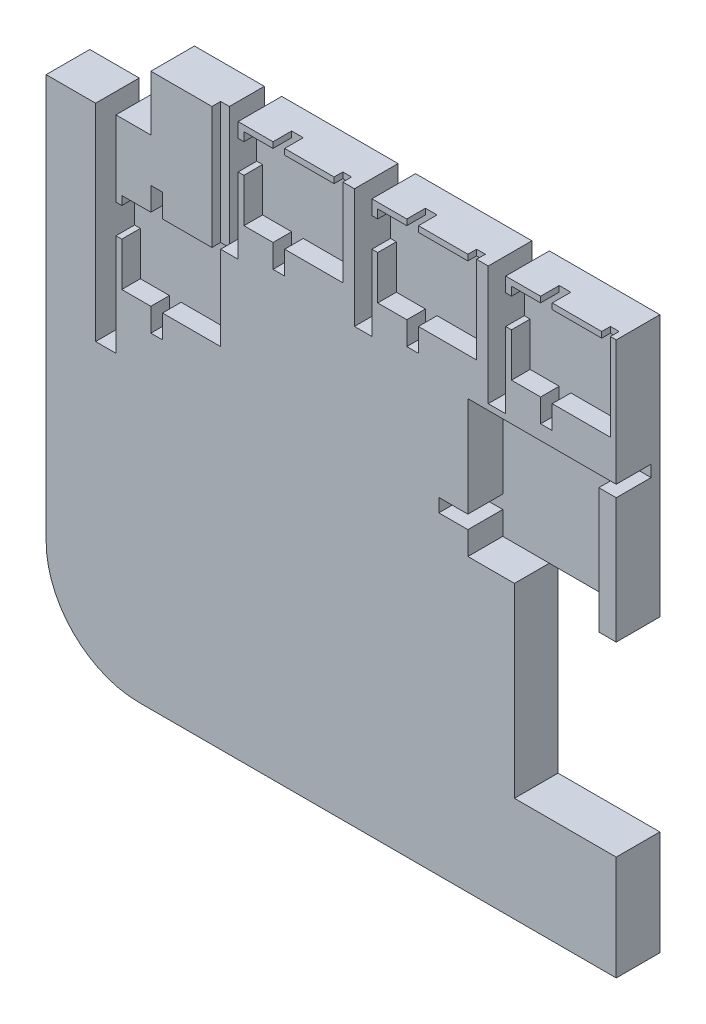
from build123d import *
from OCP.BRepAlgoAPI import BRepAlgoAPI_Cut
from OCP.TopTools import TopTools_ListOfShape
from build123d.topology import SkipClean

# Parameters (mm, degrees)
BOSS_EXTRUDE1_DEPTH = 7.5
CUT_EXTRUDE1_DEPTH  = 3.2
CUT_EXTRUDE4_REACH  = 70.655
SKETCH5_W           = 3
SKETCH5_H           = 17
CUT_EXTRUDE5_REACH  = 70.655
SKETCH8_W           = 12
SKETCH8_H           = 37
CUT_EXTRUDE6_DEPTH  = 3.2
SKETCH10_W          = 10
SKETCH10_H          = 7.5
BOSS_EXTRUDE2_DEPTH = 27.486353186
SKETCH11_W          = 3
SKETCH11_H          = 7.5
CUT_EXTRUDE7_DEPTH  = 3.5
SKETCH12_W          = 2
SKETCH12_H          = 7.5
CUT_EXTRUDE8_DEPTH  = 4
SKETCH13_W          = 2
SKETCH13_H          = 7.5
CUT_EXTRUDE9_DEPTH  = 4
SKETCH14_W          = 7.5
SKETCH14_H          = 9.5
CUT_EXTRUDE10_DEPTH = 6
SKETCH15_W          = 1.5
SKETCH15_H          = 21
SKETCH15_H_2        = 1
CUT_EXTRUDE11_DEPTH = 1.5
SKETCH16_W          = 1.5
SKETCH16_H          = 7.5
CUT_EXTRUDE12_DEPTH = 35.486360958
CUT_EXTRUDE13_DEPTH = 6


with BuildPart() as part:
    # Sketch1 → Boss-Extrude1 (new body)
    with BuildSketch(Plane.XY):
        with BuildLine():
            Line((-33, -47.5), (49, -47.5))
            Line((49, -47.5), (49, -29.5))
            Line((49, -29.5), (31.5, -29.5))
            Line((31.5, -29.5), (31.5, 2.5))
            Line((31.5, 2.5), (49, 2.5))
            Line((49, 2.5), (49, 47.5))
            Line((49, 47.5), (30, 47.5))
            Line((30, 47.5), (30, 30.5))
            Line((30, 30.5), (27, 30.5))
            Line((27, 30.5), (27, 47.5))
            Line((27, 47.5), (-49, 47.5))
            Line((-49, 47.5), (-49, -31.5))
            ThreePointArc((-49, -31.5), (-44.313708499, -42.813708499), (-33, -47.5))
        make_face()
    extrude(amount=BOSS_EXTRUDE1_DEPTH)

    # Sketch2 → Cut-Extrude1 (cut)
    with BuildSketch(Plane.XY.offset(7.5)):
        Polygon((30, 40), (31, 40), (31, 32.5), (36, 32.5), (36, 28.5), (38, 28.5), (38, 32.5), (48, 32.5), (48, 46.5), (38, 46.5), (38, 47.5), (36, 47.5), (36, 46.5), (31, 46.5), (31, 45), (30, 45), align=None)
        Polygon((-16, 40), (-15, 40), (-15, 32.5), (-10, 32.5), (-10, 28.5), (-8, 28.5), (-8, 32.5), (2, 32.5), (2, 46.5), (-8, 46.5), (-8, 47.5), (-10, 47.5), (-10, 46.5), (-15, 46.5), (-15, 45), (-16, 45), align=None)
        Polygon((7, 40), (8, 40), (8, 32.5), (13, 32.5), (13, 28.5), (15, 28.5), (15, 32.5), (25, 32.5), (25, 46.5), (15, 46.5), (15, 47.5), (13, 47.5), (13, 46.5), (8, 46.5), (8, 45), (7, 45), align=None)
    extrude(amount=-CUT_EXTRUDE1_DEPTH, mode=Mode.SUBTRACT)

    # Sketch5 → Cut-Extrude4 (cut, up to next)
    with BuildSketch(Plane.XY.offset(7.5), mode=Mode.PRIVATE) as cut_extrude4_sk1:
        with Locations((5.5, 39)):
            Rectangle(SKETCH5_W, SKETCH5_H)
    cut_extrude4_tool1 = extrude(cut_extrude4_sk1.sketch, amount=-CUT_EXTRUDE4_REACH, mode=Mode.PRIVATE) & part.part
    # Sketch5 → Cut-Extrude4 (cut, up to next)
    with BuildSketch(Plane.XY.offset(7.5), mode=Mode.PRIVATE) as cut_extrude4_sk2:
        with Locations((-17.5, 39)):
            Rectangle(SKETCH5_W, SKETCH5_H)
    cut_extrude4_tool2 = extrude(cut_extrude4_sk2.sketch, amount=-CUT_EXTRUDE4_REACH, mode=Mode.PRIVATE) & part.part
    add(cut_extrude4_tool1.solids().sort_by_distance((5.5, 39, 7.5))[0], mode=Mode.SUBTRACT)
    add(cut_extrude4_tool2.solids().sort_by_distance((-17.5, 39, 7.5))[0], mode=Mode.SUBTRACT)

    # Sketch8 → Cut-Extrude5 (cut, up to next)
    with BuildSketch(Plane.XY.offset(7.5), mode=Mode.PRIVATE) as cut_extrude5_sk1:
        with Locations((-43, 29)):
            Rectangle(SKETCH8_W, SKETCH8_H)
    cut_extrude5_tool1 = extrude(cut_extrude5_sk1.sketch, amount=-CUT_EXTRUDE5_REACH, mode=Mode.PRIVATE) & part.part
    add(cut_extrude5_tool1.solids().sort_by_distance((-43, 29, 7.5))[0], mode=Mode.SUBTRACT)

    # Sketch9 → Cut-Extrude6 (cut)
    with BuildSketch(Plane.XY.offset(7.5)):
        Polygon((-37, 20), (-36, 20), (-36, 12.5), (-31, 12.5), (-31, 8.5), (-29, 8.5), (-29, 12.5), (-19, 12.5), (-19, 26.5), (-29, 26.5), (-29, 30.5), (-31, 30.5), (-31, 26.5), (-36, 26.5), (-36, 25), (-37, 25), align=None)
    extrude(amount=-CUT_EXTRUDE6_DEPTH, mode=Mode.SUBTRACT)

    # Sketch10 → Boss-Extrude2 (add)
    with BuildSketch(Plane(origin=(0, 10.5, 0), x_dir=(1, 0, 0), z_dir=(0, 1, 0))):
        with Locations((-44, -3.75)):
            Rectangle(SKETCH10_W, SKETCH10_H)
    extrude(amount=BOSS_EXTRUDE2_DEPTH)

    # Sketch11 → Cut-Extrude7 (cut)
    with BuildSketch(Plane(origin=(0, 30.5, 0), x_dir=(1, 0, 0), z_dir=(0, 1, 0))):
        with Locations((-17.5, -3.75)):
            Rectangle(SKETCH11_W, SKETCH11_H)
        with Locations((5.5, -3.75)):
            Rectangle(SKETCH11_W, SKETCH11_H)
        with Locations((28.5, -3.75)):
            Rectangle(SKETCH11_W, SKETCH11_H)
    extrude(amount=-CUT_EXTRUDE7_DEPTH, mode=Mode.SUBTRACT)

    # Sketch12 → Cut-Extrude8 (cut)
    with BuildSketch(Plane(origin=(0, 10.5, 0), x_dir=(1, 0, 0), z_dir=(0, 1, 0))):
        with Locations((-38, -3.75)):
            Rectangle(SKETCH12_W, SKETCH12_H)
    extrude(amount=-CUT_EXTRUDE8_DEPTH, mode=Mode.SUBTRACT)

    # Sketch13 → Cut-Extrude9 (cut)
    with BuildSketch(Plane(origin=(0, 6.5, 0), x_dir=(1, 0, 0), z_dir=(0, 1, 0))):
        with Locations((-38, -3.75)):
            Rectangle(SKETCH13_W, SKETCH13_H)
    extrude(amount=-CUT_EXTRUDE9_DEPTH, mode=Mode.SUBTRACT)

    # Sketch14 → Cut-Extrude10 (cut)
    with BuildSketch(Plane.ZY.offset(37)):
        with Locations((3.75, 42.75)):
            Rectangle(SKETCH14_W, SKETCH14_H)
    extrude(amount=-CUT_EXTRUDE10_DEPTH, mode=Mode.SUBTRACT)

    # Sketch15 → Cut-Extrude11 (cut)
    with BuildSketch(Plane.XY.offset(7.5)):
        with Locations((-19.75, 37)):
            Rectangle(SKETCH15_W, SKETCH15_H)
        with Locations((1.25, 47)):
            Rectangle(SKETCH15_W, SKETCH15_H_2)
        with Locations((24.25, 47)):
            Rectangle(SKETCH15_W, SKETCH15_H_2)
        with Locations((47.25, 47)):
            Rectangle(SKETCH15_W, SKETCH15_H_2)
    extrude(amount=-CUT_EXTRUDE11_DEPTH, mode=Mode.SUBTRACT)


with BuildPart() as cut_extrude12_tool:
    # Sketch16 → Cut-Extrude12 (new body)
    with BuildSketch(Plane(origin=(0, 37.986353186, 0), x_dir=(1, 0, 0), z_dir=(0, 1, 0))):
        with Locations((-39.75, -3.75)):
            Rectangle(SKETCH16_W, SKETCH16_H)
    extrude(amount=-CUT_EXTRUDE12_DEPTH)


with BuildPart() as part_1:
    add(part.part)

    # Cut-Extrude12: cut by cut_extrude12_tool, with a tolerance
    cut_extrude12_stock = TopTools_ListOfShape()
    cut_extrude12_stock.Append(part_1.part.wrapped)
    cut_extrude12_tools = TopTools_ListOfShape()
    cut_extrude12_tools.Append(cut_extrude12_tool.part.wrapped)
    cut_extrude12_cut = BRepAlgoAPI_Cut()
    cut_extrude12_cut.SetArguments(cut_extrude12_stock)
    cut_extrude12_cut.SetTools(cut_extrude12_tools)
    cut_extrude12_cut.SetFuzzyValue(0.00001)
    cut_extrude12_cut.Build()
    add(Compound.cast(cut_extrude12_cut.Shape()).solids(), mode=Mode.REPLACE)

    # Sketch18 → Cut-Extrude13 (cut)
    with SkipClean():  # the faces are left unmerged after this step: merging them gives an invalid solid
        with BuildSketch(Plane.XY.offset(7.5)):
            Polygon((23.5, 6.5), (23.5, 2.5), (46, 2.5), (46, 24), (49, 24), (49, 26), (46, 26), (23.5, 26), (23.5, 8.8), (18.5, 8.8), (18.5, 6.5), align=None)
        extrude(amount=-CUT_EXTRUDE13_DEPTH, mode=Mode.SUBTRACT)


solid = part_1.part
